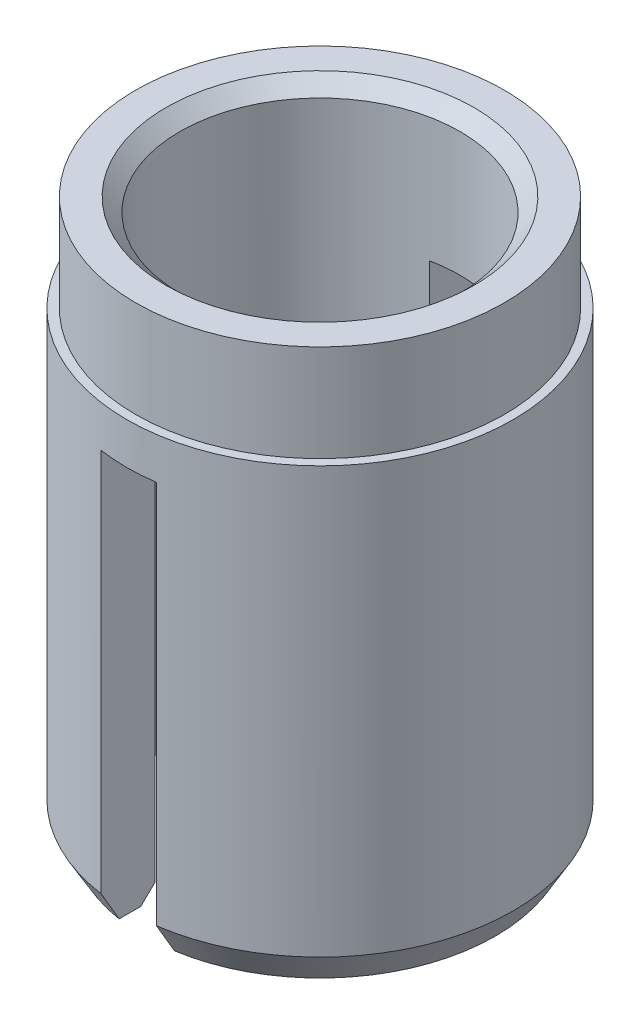
from build123d import *

# Parameters (mm, degrees)
BOSS_EXTRUDE1_DEPTH      = 4.7625
BOSS_EXTRUDE1_DEPTH_BACK = 4.7625
SKETCH11_R               = 3.3274
SKETCH11_R_2             = 2.413
CUT_EXTRUDE1_START       = 3.095625
SKETCH12_R               = 3.3274
SKETCH12_R_2             = 3.175
CUT_EXTRUDE1_DEPTH       = 1.666875
CHAMFER2_SIZE            = 0.3048
CHAMFER2_SIZE2           = 0.527929086
EXTRUDE4_DEPTH           = 7.695116711
EXTRUDE4_DEPTH_BACK      = 7.695116711
SKETCH8_W                = 0.9525
SKETCH8_H                = 7.14375


# Read off the part's stored shape, not the designer's step: Cut-Extrude3, Cut-Extrude10
with BuildPart() as part:
    # Sketch11 → Boss-Extrude1 (new, two sides: drawn at the far end of the back side and taken through both)
    with BuildSketch(Plane(origin=(0, 0, 0), x_dir=(1, 0, 0), z_dir=(0, 1, 0)).offset(-BOSS_EXTRUDE1_DEPTH_BACK)):
        with Locations(Location((0, 0, 0), (0, 0, 90))):
            Circle(SKETCH11_R)
        with Locations(Location((0, 0, 0), (0, 0, 90))):
            Circle(SKETCH11_R_2, mode=Mode.SUBTRACT)
    extrude(amount=BOSS_EXTRUDE1_DEPTH + BOSS_EXTRUDE1_DEPTH_BACK)

    # Sketch12 → Cut-Extrude1 (cut)
    with BuildSketch(Plane(origin=(0, 0, 0), x_dir=(1, 0, 0), z_dir=(0, 1, 0)).offset(CUT_EXTRUDE1_START)):
        with Locations(Location((0, 0, 0), (0, 0, 90))):
            Circle(SKETCH12_R)
        with Locations(Location((0, 0, 0), (0, 0, 270))):
            Circle(SKETCH12_R_2, mode=Mode.SUBTRACT)
    extrude(amount=CUT_EXTRUDE1_DEPTH, mode=Mode.SUBTRACT)

    # Cut-Extrude3 outline → Cut-Extrude3 (revolve, cut)
    with BuildSketch(Plane.XY):
        Polygon((2.413, 4.7625), (2.413, 4.52537515), (2.6543, 4.7625), align=None)
    revolve(axis=Axis((0, 0, 0), (0, 1, 0)), mode=Mode.SUBTRACT)

    # Cut-Extrude10 outline → Cut-Extrude10 (revolve, cut)
    with BuildSketch(Plane.XY):
        Polygon((2.6543, -4.7625), (2.413, -4.52537515), (2.413, -4.7625), align=None)
    revolve(axis=Axis((0, 0, 0), (0, 1, 0)), mode=Mode.SUBTRACT)

    # Chamfer2
    chamfer2_edges = [part.edges().sort_by_distance(p)[0] for p in [
        (0, -4.7625, 3.3274),
    ]]
    chamfer2_side = [part.faces().sort_by_distance(p)[0] for p in [
        (0, -4.7625, 3.233286916),
    ]]
    chamfer(chamfer2_edges, length=CHAMFER2_SIZE, length2=CHAMFER2_SIZE2, reference=chamfer2_side[0])

    # Sketch8 → Extrude4 (cut, two sides: drawn at the far end of the back side and taken through both)
    with BuildSketch(Plane.XY.offset(-EXTRUDE4_DEPTH_BACK)):
        with Locations((0, -1.190625)):
            Rectangle(SKETCH8_W, SKETCH8_H)
    extrude(amount=EXTRUDE4_DEPTH + EXTRUDE4_DEPTH_BACK, mode=Mode.SUBTRACT)


solid = part.part
